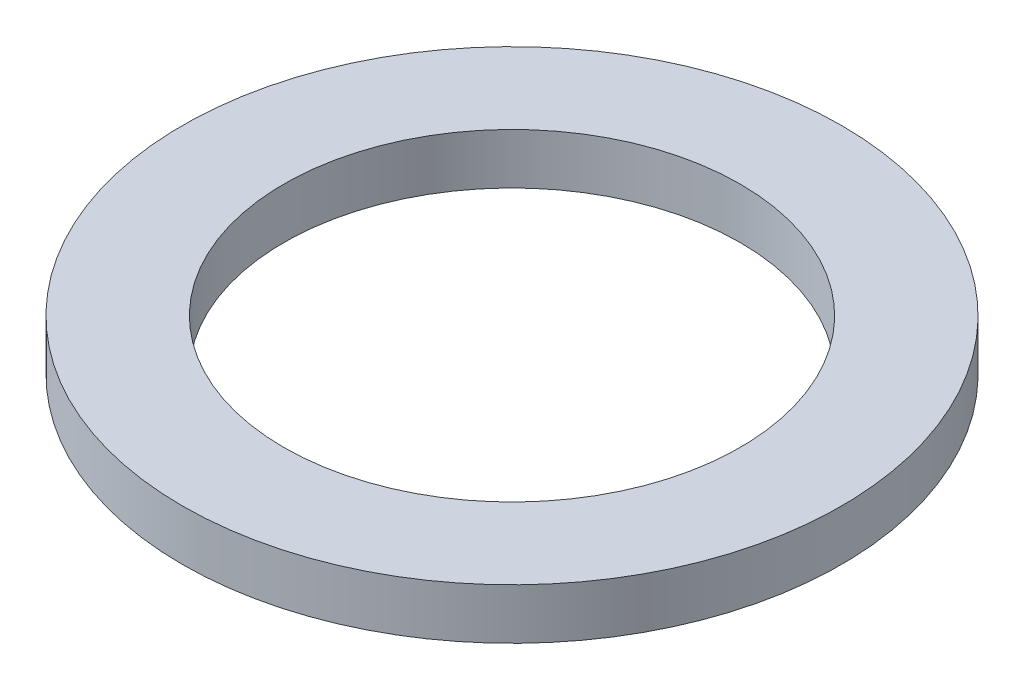
from build123d import *

# Parameters (mm, degrees)
ESQUISSE1_R        = 3.25
ESQUISSE1_R_2      = 2.25
BOSS_EXTRU_1_DEPTH = 0.5


with BuildPart() as part:
    # Esquisse1 → Boss.-Extru.1 (new body)
    with BuildSketch(Plane(origin=(0, 0, 0), x_dir=(1, 0, 0), z_dir=(0, 1, 0))):
        Circle(ESQUISSE1_R)
        Circle(ESQUISSE1_R_2, mode=Mode.SUBTRACT)
    extrude(amount=BOSS_EXTRU_1_DEPTH)


solid = part.part
